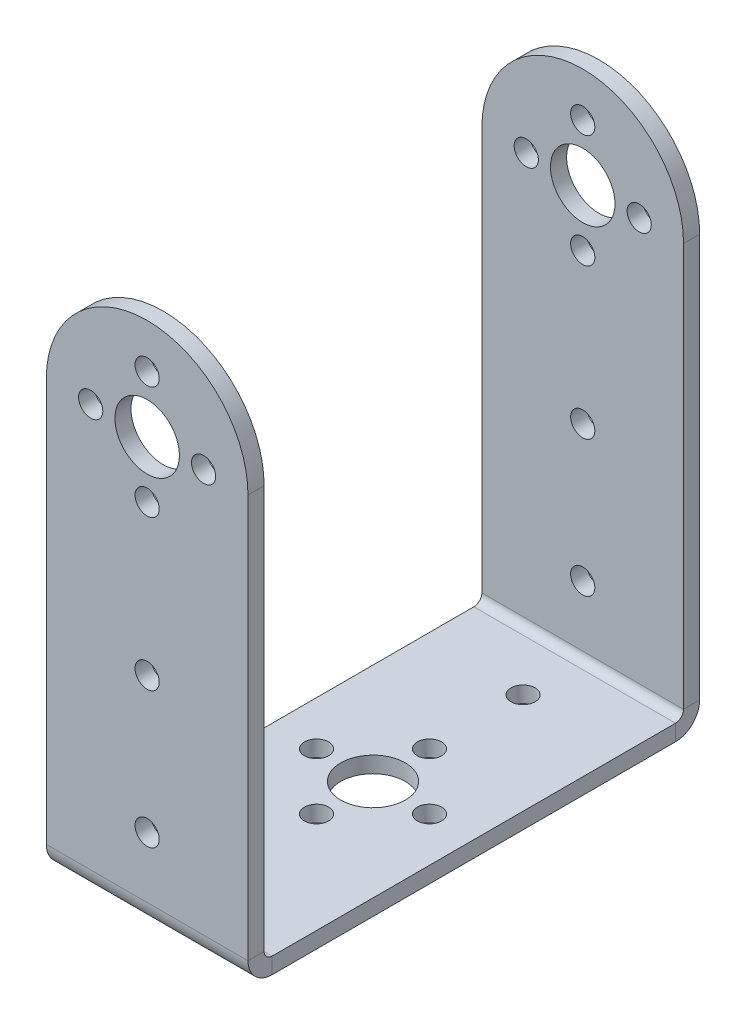
from build123d import *

# Parameters (mm, degrees)
BASE_FLANGE1_DEPTH           = 2
EDGE_FLANGE1_DEPTH           = 25
EDGE_FLANGE2_STRIP_W         = 10
EDGE_FLANGE2_STRIP_H         = 2
EDGE_FLANGE2_STRIP_CUT_DEPTH = 25
EDGE_FLANGE2_DEPTH           = 25
CUT_EXTRUDE1_START           = -2
CUT_EXTRUDE1_DEPTH           = 2
SKETCH19_R                   = 4
CUT_EXTRUDE2_DEPTH           = 85.843974447
M3X0_5_TAPPED_HOLE1_D        = 3
SKETCH22_R                   = 4
CUT_EXTRUDE3_DEPTH           = 86.583292762
M3X0_5_TAPPED_HOLE2_D        = 3


# Sheet-metal steps are written as plain solids
with BuildPart() as part:
    # Sketch8 → Base-Flange1 (new body)
    with BuildSketch(Plane.XY):
        with BuildLine():
            Line((-12.5, 0), (12.5, 0))
            Line((12.5, 0), (12.5, 50))
            ThreePointArc((12.5, 50), (0, 62.5), (-12.5, 50))
            Line((-12.5, 50), (-12.5, 0))
        make_face()
    extrude(amount=-BASE_FLANGE1_DEPTH)

    # Edge-Flange1 section (across the edge) → Edge-Flange1 (add)
    with BuildSketch(Plane(origin=(12.5, -1, -2), x_dir=(0, 1, 0), z_dir=(-1, 0, 0))):
        with BuildLine():
            Line((-2, 1), (-2, 52))
            Line((-2, 52), (0, 52))
            Line((0, 52), (0, 1))
            ThreePointArc((0, 1), (0.292893219, 0.292893219), (1, 0))
            Line((1, 0), (1, -2))
            ThreePointArc((1, -2), (-1.121320344, -1.121320344), (-2, 1))
        make_face()
    extrude(amount=EDGE_FLANGE1_DEPTH)

    # Edge-Flange2 strip (across the edge) → Edge-Flange2 strip cut (cut)
    with BuildSketch(Plane(origin=(12.5, -1, -54), x_dir=(0, 0, 1), z_dir=(-1, 0, 0))):
        with Locations((-4, -1)):
            Rectangle(EDGE_FLANGE2_STRIP_W, EDGE_FLANGE2_STRIP_H)
    extrude(amount=EDGE_FLANGE2_STRIP_CUT_DEPTH, mode=Mode.SUBTRACT)

    # Edge-Flange2 section (across the edge) → Edge-Flange2 (add)
    with BuildSketch(Plane(origin=(12.5, -1, -54), x_dir=(0, 0, 1), z_dir=(-1, 0, 0))):
        with BuildLine():
            Line((-2, 1), (-2, 63.5))
            Line((-2, 63.5), (0, 63.5))
            Line((0, 63.5), (0, 1))
            ThreePointArc((0, 1), (0.292893219, 0.292893219), (1, 0))
            Line((1, 0), (1, -2))
            ThreePointArc((1, -2), (-1.121320344, -1.121320344), (-2, 1))
        make_face()
    extrude(amount=EDGE_FLANGE2_DEPTH)

    # Sketch18 → Cut-Extrude1 (cut)
    with BuildSketch(Plane(origin=(0, 0, -56), x_dir=(-1, 0, 0), z_dir=(0, 0, -1)).offset(CUT_EXTRUDE1_START)):
        with BuildLine():
            ThreePointArc((0, 62.5), (8.838834765, 58.838834765), (12.5, 50))
            Line((12.5, 50), (12.5, 62.5))
            Line((12.5, 62.5), (0, 62.5))
        make_face()
        with BuildLine():
            ThreePointArc((-12.5, 50), (-8.838834765, 58.838834765), (0, 62.5))
            Line((0, 62.5), (-12.5, 62.5))
            Line((-12.5, 62.5), (-12.5, 50))
        make_face()
    extrude(amount=CUT_EXTRUDE1_DEPTH, mode=Mode.SUBTRACT)

    # Sketch19 → Cut-Extrude2 (cut, through all)
    with BuildSketch(Plane.XY):
        with Locations((0, 50)):
            Circle(SKETCH19_R)
    extrude(amount=-CUT_EXTRUDE2_DEPTH, mode=Mode.SUBTRACT)

    # M3x0.5 Tapped Hole1 (through all)
    with Locations(Plane.XY):
        with Locations((0, 57), (-7, 50), (0, 43), (7, 50), (0, 24.4), (0, 7.53)):
            Hole(M3X0_5_TAPPED_HOLE1_D / 2)

    # Sketch22 → Cut-Extrude3 (cut, through all)
    with BuildSketch(Plane(origin=(0, -1, 0), x_dir=(1, 0, 0), z_dir=(0, 1, 0))):
        with Locations(Location((0, 28, 0), (0, 0, 270))):
            Circle(SKETCH22_R)
    extrude(amount=-CUT_EXTRUDE3_DEPTH, mode=Mode.SUBTRACT)

    # M3x0.5 Tapped Hole2 (through all)
    with Locations(Plane(origin=(0, -1, 0), x_dir=(1, 0, 0), z_dir=(0, 1, 0))):
        with Locations((7, 28), (-7, 28), (0, 35), (0, 21), (0, 9.4), (0, 46.6)):
            Hole(M3X0_5_TAPPED_HOLE2_D / 2)


solid = part.part
